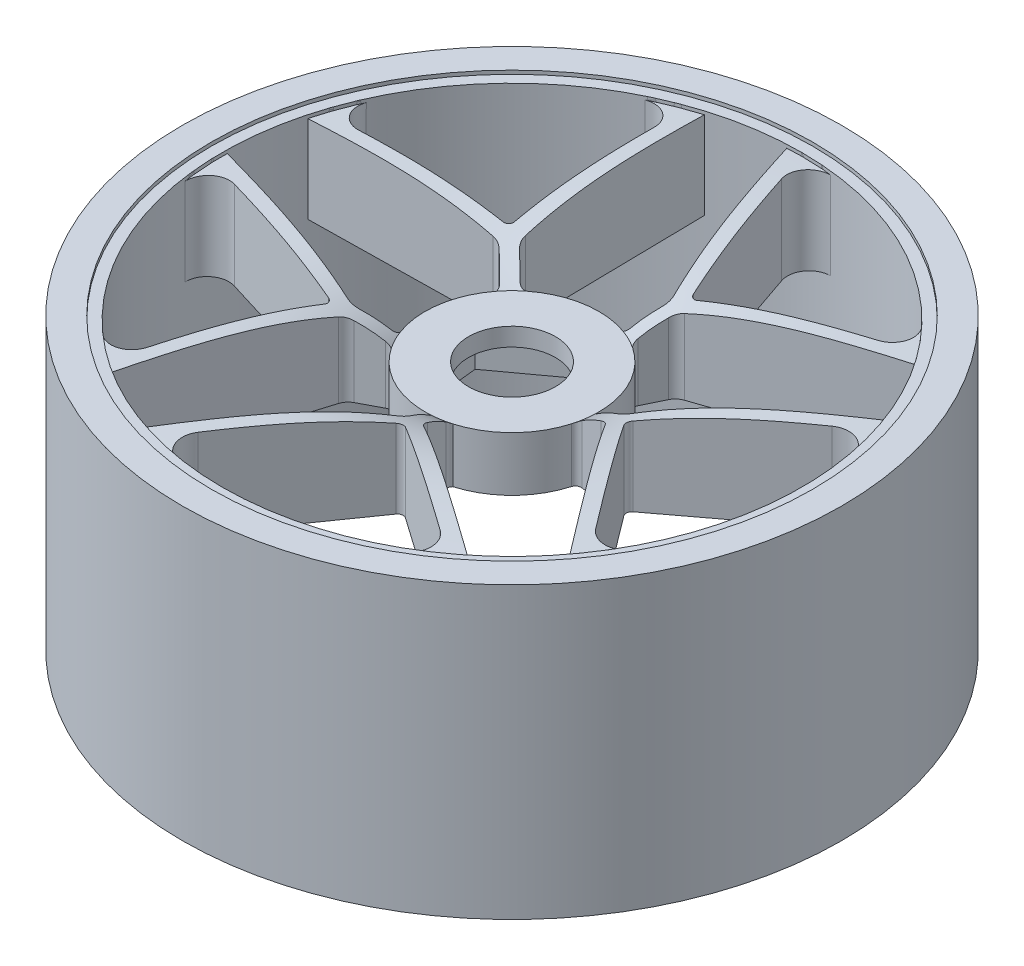
from build123d import *

# Parameters (mm, degrees)
SKETCH1_R               = 50.5
SKETCH1_R_2             = 45
SKETCH1_R_3             = 40
BOSS_EXTRUDE1_DEPTH     = 40
FILLET1_R               = 5
FILLET2_R               = 5
CUT_EXTRUDE1_START      = -0.5
SKETCH2_R               = 41.5
SKETCH2_R_2             = 40
CUT_EXTRUDE1_DEPTH      = 0.5
SKETCH3_R               = 1
BOSS_EXTRUDE2_DEPTH     = 5
SKETCH4_R               = 12
BOSS_EXTRUDE3_DEPTH     = 7.5
CUT_EXTRUDE2_DEPTH      = 5
SKETCH6_R               = 6
CUT_EXTRUDE3_DEPTH      = 79.259184829
BOSS_EXTRUDE10_START    = -12.5
BOSS_EXTRUDE10_DEPTH    = 12.5
CIRPATTERN2_START       = 27
CIRPATTERN2_DEPTH       = 12.5
CUT_EXTRUDE4_DEPTH      = 82.85658196
CUT_EXTRUDE4_DEPTH_BACK = 82.85658196
SKETCH9_R               = 56.191284202
SKETCH9_R_2             = 45.5


# Read off the part's stored shape, not the designer's step: Boss-Extrude10, CirPattern2, Cut-Revolve1
with BuildPart() as part:
    # Sketch1 → Boss-Extrude1 (new body)
    # profile 1 of 2: a face of its own
    with BuildSketch(Plane(origin=(0, 0, 0), x_dir=(1, 0, 0), z_dir=(0, 1, 0))):
        with Locations(Location((0, 0, 0), (0, 0, 270))):
            Circle(SKETCH1_R)
        Circle(SKETCH1_R_2, mode=Mode.SUBTRACT)
    # profile 2 of 2: a face of its own
    with BuildSketch(Plane(origin=(0, 0, 0), x_dir=(1, 0, 0), z_dir=(0, 1, 0))):
        Circle(SKETCH1_R_2)
        with Locations(Location((0, 0, 0), (0, 0, 270))):
            Circle(SKETCH1_R_3, mode=Mode.SUBTRACT)
    extrude(amount=BOSS_EXTRUDE1_DEPTH)

    # Fillet1
    fillet1_edges = [part.edges().sort_by_distance(p)[0] for p in [
        (0, 40, -50.5),
    ]]
    fillet(fillet1_edges, radius=FILLET1_R)

    # Fillet2
    fillet2_edges = [part.edges().sort_by_distance(p)[0] for p in [
        (0, 0, -50.5),
    ]]
    fillet(fillet2_edges, radius=FILLET2_R)

    # Sketch2 → Cut-Extrude1 (cut)
    with BuildSketch(Plane(origin=(0, 40, 0), x_dir=(1, 0, 0), z_dir=(0, 1, 0)).offset(CUT_EXTRUDE1_START)):
        with Locations(Location((0, 0, 0), (0, 0, 270))):
            Circle(SKETCH2_R)
        with Locations(Location((0, 0, 0), (0, 0, 270))):
            Circle(SKETCH2_R_2, mode=Mode.SUBTRACT)
    extrude(amount=CUT_EXTRUDE1_DEPTH, mode=Mode.SUBTRACT)

    # Sketch9 → Cut-Extrude4 (cut, two sides: drawn at the far end of the back side and taken through both)
    with BuildSketch(Plane(origin=(0, 40, 0), x_dir=(1, 0, 0), z_dir=(0, 1, 0)).offset(-CUT_EXTRUDE4_DEPTH_BACK)):
        Circle(SKETCH9_R)
        with Locations(Location((0, 0, 0), (0, 0, 270))):
            Circle(SKETCH9_R_2, mode=Mode.SUBTRACT)
    extrude(amount=CUT_EXTRUDE4_DEPTH + CUT_EXTRUDE4_DEPTH_BACK, mode=Mode.SUBTRACT)


with BuildPart() as body_2:
    # Sketch3 → Boss-Extrude2 (new body)
    with BuildSketch(Plane(origin=(0, 39.5, 0), x_dir=(1, 0, 0), z_dir=(0, 1, 0))):
        with Locations(Location((0, 0, 0), (0, 0, 270))):
            Circle(SKETCH3_R)
    extrude(amount=-BOSS_EXTRUDE2_DEPTH)

    # Sketch4 → Boss-Extrude3 (add)
    with BuildSketch(Plane.XZ.offset(-34.5)):
        with Locations(Location((0, 0, 0), (0, 0, 270))):
            Circle(SKETCH4_R)
    extrude(amount=BOSS_EXTRUDE3_DEPTH)

    # Sketch5 → Cut-Extrude2 (cut)
    with BuildSketch(Plane.XZ.offset(-27)):
        Polygon((1.066294458, 9.94298829), (-8.077733219, 5.894932233), (-9.144027677, -4.048056056), (-1.066294458, -9.94298829), (8.077733219, -5.894932233), (9.144027677, 4.048056056), align=None)
    extrude(amount=-CUT_EXTRUDE2_DEPTH, mode=Mode.SUBTRACT)

    # Sketch6 → Cut-Extrude3 (cut, through all)
    with BuildSketch(Plane.XZ.offset(-32)):
        with Locations(Location((0, 0, 0), (0, 0, 270))):
            Circle(SKETCH6_R)
    extrude(amount=-CUT_EXTRUDE3_DEPTH, mode=Mode.SUBTRACT)

    # Boss-Extrude10 outline → Boss-Extrude10 (add)
    with BuildSketch(Plane(origin=(0, 39.5, 0), x_dir=(1, 0, 0), z_dir=(0, 1, 0)).offset(BOSS_EXTRUDE10_START)):
        with BuildLine():
            ThreePointArc((-9.907874683, -6.770082663), (-10.682049717, -5.467523557), (-11.285904868, -4.077787551))
            ThreePointArc((-11.285904868, -4.077787551), (-11.291897259, -4.637537864), (-11.663342081, -5.056327867))
            Line((-11.663342081, -5.056327867), (-14.441281094, -6.530254709))
            ThreePointArc((-14.441281094, -6.530254709), (-15.188724822, -6.754494743), (-15.965085937, -6.675633223))
            Line((-15.965085937, -6.675633223), (-39.993984407, 0.693693915))
            ThreePointArc((-39.993984407, 0.693693915), (-39.913717484, -2.625863016), (-39.558397626, -5.927324632))
            ThreePointArc((-39.558397626, -5.927324632), (-38.549233859, -3.209595167), (-35.711897206, -2.614628217))
            Line((-35.711897206, -2.614628217), (-16.968675274, -8.362912276))
            ThreePointArc((-16.968675274, -8.362912276), (-16.496554918, -8.752791347), (-16.438401548, -9.362316987))
            Line((-16.438401548, -9.362316987), (-22.186706389, -28.105606681))
            ThreePointArc((-22.186706389, -28.105606681), (-24.270105502, -30.121529322), (-27.086328062, -29.433498469))
            ThreePointArc((-27.086328062, -29.433498469), (-25.333453103, -30.955066692), (-23.495271849, -32.372398749))
            Line((-23.495271849, -32.372398749), (-22.678682838, -32.949618279))
            Line((-22.678682838, -32.949618279), (-21.84791965, -33.506244298))
            Line((-21.84791965, -33.506244298), (-14.474389556, -9.463641401))
            ThreePointArc((-14.474389556, -9.463641401), (-14.104425603, -8.776547206), (-13.499682622, -8.283335601))
            Line((-13.499682622, -8.283335601), (-10.652684086, -6.77276696))
            ThreePointArc((-10.652684086, -6.77276696), (-10.280610826, -6.679459968), (-9.907874683, -6.770082663))
        make_face()
    extrude(amount=BOSS_EXTRUDE10_DEPTH)

    # CirPattern2 outline → CirPattern2 (add)
    with BuildSketch(Plane(origin=(0, 0, 0), x_dir=(1, 0, 0), z_dir=(0, 1, 0)).offset(CIRPATTERN2_START)):
        with BuildLine():
            ThreePointArc((-9.500432888, 7.330878183), (-8.500858804, 8.469675294), (-7.365742824, 9.473427714))
            ThreePointArc((-7.365742824, 9.473427714), (-7.899948758, 9.306154457), (-8.413024481, 9.530006248))
            Line((-8.413024481, 9.530006248), (-10.673242573, 11.716514805))
            ThreePointArc((-10.673242573, 11.716514805), (-11.117480333, 12.358082052), (-11.282387348, 13.120814899))
            Line((-11.282387348, 13.120814899), (-11.699078736, 38.250902692))
            ThreePointArc((-11.699078736, 38.250902692), (-14.831361144, 37.148764806), (-17.861437852, 35.790627793))
            ThreePointArc((-17.861437852, 35.790627793), (-14.964874781, 35.670680608), (-13.522242341, 33.156067994))
            Line((-13.522242341, 33.156067994), (-13.197211247, 13.553887176))
            ThreePointArc((-13.197211247, 13.553887176), (-13.422115065, 12.984394777), (-13.983838017, 12.740733854))
            Line((-13.983838017, 12.740733854), (-33.586089702, 12.415701585))
            ThreePointArc((-33.586089702, 12.415701585), (-36.147151798, 13.774177532), (-36.363056203, 16.665177575))
            ThreePointArc((-36.363056203, 16.665177575), (-37.268485425, 14.527903984), (-38.048419067, 12.341710032))
            Line((-38.048419067, 12.341710032), (-38.345047581, 11.386717087))
            Line((-38.345047581, 11.386717087), (-38.61771044, 10.424607444))
            Line((-38.61771044, 10.424607444), (-13.473290178, 10.841536484))
            ThreePointArc((-13.473290178, 10.841536484), (-12.705499618, 10.70200364), (-12.049551649, 10.279269655))
            Line((-12.049551649, 10.279269655), (-9.733144569, 8.038404527))
            ThreePointArc((-9.733144569, 8.038404527), (-9.529427386, 7.713375274), (-9.500432888, 7.330878183))
        make_face()
        with BuildLine():
            ThreePointArc((4.03628425, 11.300814548), (5.428230042, 10.702070763), (6.73362545, 9.932687868))
            ThreePointArc((6.73362545, 9.932687868), (6.409460418, 10.389057624), (6.463807004, 10.946195641))
            Line((6.463807004, 10.946195641), (7.844854414, 13.771459088))
            ThreePointArc((7.844854414, 13.771459088), (8.317744107, 14.392209487), (8.992187082, 14.784742791))
            Line((8.992187082, 14.784742791), (32.763556111, 22.946664049))
            ThreePointArc((32.763556111, 22.946664049), (30.747432198, 25.585062307), (28.519421945, 28.047149087))
            ThreePointArc((28.519421945, 28.047149087), (29.300432607, 25.255288185), (27.354691835, 23.106205171))
            Line((27.354691835, 23.106205171), (8.812350166, 16.739675231))
            ThreePointArc((8.812350166, 16.739675231), (8.201231607, 16.777588643), (7.795914361, 17.23652355))
            Line((7.795914361, 17.23652355), (1.429361404, 35.778932255))
            ThreePointArc((1.429361404, 35.778932255), (1.929937095, 38.634439204), (4.612723394, 39.733144639))
            ThreePointArc((4.612723394, 39.733144639), (2.300262401, 39.933805139), (-0.019944352, 39.999995028))
            Line((-0.019944352, 39.999995028), (-1.019859867, 39.986996459))
            Line((-1.019859867, 39.986996459), (-2.01913797, 39.949006018))
            Line((-2.01913797, 39.949006018), (6.147438285, 16.164079439))
            ThreePointArc((6.147438285, 16.164079439), (6.251994995, 15.390749203), (6.052650154, 14.636273627))
            Line((6.052650154, 14.636273627), (4.637269925, 11.740774173))
            ThreePointArc((4.637269925, 11.740774173), (4.391100809, 11.446588055), (4.03628425, 11.300814548))
        make_face()
        with BuildLine():
            ThreePointArc((11.994993743, -0.346590692), (11.855689469, -1.855431813), (11.52735222, -3.334689012))
            ThreePointArc((11.52735222, -3.334689012), (11.861213145, -2.885363735), (12.407876906, -2.764885294))
            Line((12.407876906, -2.764885294), (15.521629237, -3.205285014))
            ThreePointArc((15.521629237, -3.205285014), (16.258128901, -3.463207416), (16.839864598, -3.98334134))
            Line((16.839864598, -3.98334134), (31.948070005, -24.069084381))
            ThreePointArc((31.948070005, -24.069084381), (33.834319309, -21.336326696), (35.487409954, -18.45653637))
            ThreePointArc((35.487409954, -18.45653637), (33.073538017, -20.062054114), (30.428371647, -18.875647848))
            Line((30.428371647, -18.875647848), (18.643543171, -3.208198923))
            ThreePointArc((18.643543171, -3.208198923), (18.490754948, -2.615274747), (18.801978065, -2.087976452))
            Line((18.801978065, -2.087976452), (34.469483632, 9.69689463))
            ThreePointArc((34.469483632, 9.69689463), (37.339918519, 10.103219032), (39.213876041, 7.891256292))
            ThreePointArc((39.213876041, 7.891256292), (38.690125771, 10.152544892), (38.036092779, 12.379646445))
            Line((38.036092779, 12.379646445), (37.714739519, 13.326605833))
            Line((37.714739519, 13.326605833), (37.369814547, 14.265236092))
            Line((37.369814547, 14.265236092), (17.272615982, -0.851585994))
            ThreePointArc((17.272615982, -0.851585994), (16.569445022, -1.18999752), (15.790295166, -1.233555084))
            Line((15.790295166, -1.233555084), (12.599134998, -0.782207034))
            ThreePointArc((12.599134998, -0.782207034), (12.243276933, -0.638994801), (11.994993743, -0.346590692))
        make_face()
        with BuildLine():
            ThreePointArc((3.377029578, -11.515019376), (1.89898901, -11.848790687), (0.390670022, -11.99363902))
            ThreePointArc((0.390670022, -11.99363902), (0.921172454, -12.172310482), (1.204682652, -12.654988728))
            Line((1.204682652, -12.654988728), (1.748040016, -15.75243417))
            ThreePointArc((1.748040016, -15.75243417), (1.730332147, -16.53258938), (1.415421606, -17.246583128))
            Line((1.415421606, -17.246583128), (-13.018562973, -37.822176274))
            ThreePointArc((-13.018562973, -37.822176274), (-9.836672879, -38.7716374), (-6.586996421, -39.453915879))
            ThreePointArc((-6.586996421, -39.453915879), (-8.859861984, -37.654319512), (-8.548923935, -34.7719971))
            Line((-8.548923935, -34.7719971), (2.709993184, -18.722451208))
            ThreePointArc((2.709993184, -18.722451208), (3.226683428, -18.393917326), (3.824347139, -18.526963966))
            Line((3.824347139, -18.526963966), (19.873951055, -29.785921788))
            ThreePointArc((19.873951055, -29.785921788), (21.147401687, -32.390306446), (19.62278483, -34.856080037))
            ThreePointArc((19.62278483, -34.856080037), (21.611550355, -33.659187323), (23.527542489, -32.348952756))
            Line((23.527542489, -32.348952756), (24.328850767, -31.7507011))
            Line((24.328850767, -31.7507011), (25.114953513, -31.132605256))
            Line((25.114953513, -31.132605256), (4.527625467, -16.690388528))
            ThreePointArc((4.527625467, -16.690388528), (3.988485204, -16.126208116), (3.706288951, -15.398652596))
            Line((3.706288951, -15.398652596), (3.149423732, -12.224204706))
            ThreePointArc((3.149423732, -12.224204706), (3.17566047, -11.841508561), (3.377029578, -11.515019376))
        make_face()
    extrude(amount=CIRPATTERN2_DEPTH)

    # Cut-Revolve1 outline → Cut-Revolve1 (revolve, cut)
    with BuildSketch(Plane.XY):
        with BuildLine():
            Line((12, 39.5), (12, 34.5))
            add(Edge.make_bspline(
                [(12, 34.5), (18.205969075, 39.5), (28.545558422, 39.5), (39.997606669, 39.038683727)],
                knots=[0, 0, 0, 0, 1, 1, 1, 1], degree=3))
            Line((39.997606669, 39.038683727), (40, 39.5))
            Line((40, 39.5), (12, 39.5))
        make_face()
    revolve(axis=Axis((0, 0, 0), (0, 1, 0)), mode=Mode.SUBTRACT)


solid = Compound([part.part, body_2.part])
